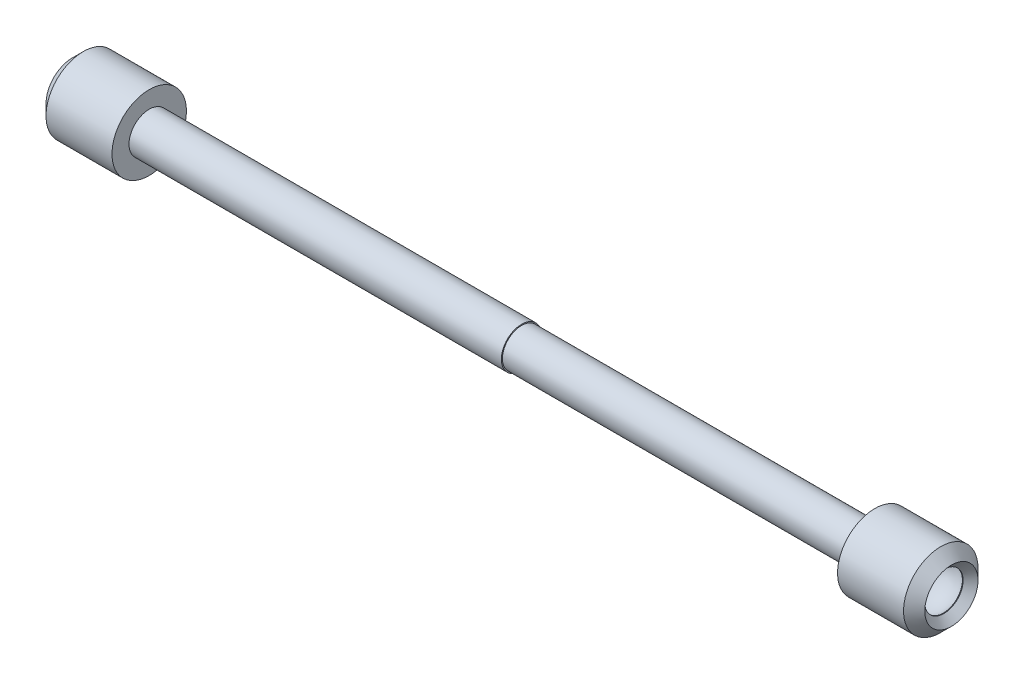
from build123d import *

# Parameters (mm, degrees)
SZKIC1_R                    = 9
DODANIE_WYCI_GNI_CIE1_DEPTH = 166
SZKIC2_R                    = 9.5
DODANIE_WYCI_GNI_CIE2_DEPTH = 175
SZKIC3_R                    = 17.5
DODANIE_WYCI_GNI_CIE3_DEPTH = 36
SFAZOWANIE1_SIZE            = 5
WYTNIJ_WYCI_GNI_CIE1_START  = -10
SZKIC8_R                    = 9
WYTNIJ_WYCI_GNI_CIE1_DEPTH  = 10
SFAZOWANIE3_SIZE            = 3.5
SFAZOWANIE1_OF_LUSTRO7_SIZE = 5
SFAZOWANIE3_OF_LUSTRO7_SIZE = 3.5


with BuildPart() as part:
    # Szkic1 → Dodanie-wyciągnięcie1 (new body)
    with BuildSketch(Plane(origin=(0, 0, 0), x_dir=(0, 0, -1), z_dir=(1, 0, 0))):
        Circle(SZKIC1_R)
    extrude(amount=DODANIE_WYCI_GNI_CIE1_DEPTH)

    # Szkic2 → Dodanie-wyciągnięcie2 (add)
    with BuildSketch(Plane.ZY):
        Circle(SZKIC2_R)
    extrude(amount=DODANIE_WYCI_GNI_CIE2_DEPTH)

    # Szkic3 → Dodanie-wyciągnięcie3 (add)
    with BuildSketch(Plane(origin=(166, 0, 0), x_dir=(0, 0, -1), z_dir=(1, 0, 0))):
        Circle(SZKIC3_R)
    dodanie_wyci_gni_cie3 = extrude(amount=DODANIE_WYCI_GNI_CIE3_DEPTH)

    # Sfazowanie1
    sfazowanie1_edges = [part.edges().sort_by_distance(p)[0] for p in [
        (202, 0, 17.5),
    ]]
    chamfer(sfazowanie1_edges, length=SFAZOWANIE1_SIZE)

    # Szkic8 → Wytnij-wyciągnięcie1 (cut)
    with BuildSketch(Plane(origin=(202, 0, 0), x_dir=(0, 0, -1), z_dir=(1, 0, 0)).offset(WYTNIJ_WYCI_GNI_CIE1_START)):
        Circle(SZKIC8_R)
    wytnij_wyci_gni_cie1 = extrude(amount=WYTNIJ_WYCI_GNI_CIE1_DEPTH, mode=Mode.SUBTRACT)

    # Szkic4 → Wycięcie-obrót9 (revolve, cut)
    with BuildSketch(Plane.XY):
        with BuildLine():
            Line((189.5, 12.5), (189.5, -12.5))
            ThreePointArc((189.5, -12.5), (202, 0), (189.5, 12.5))
        make_face()
    wyci_cie_obr_t9 = revolve(axis=Axis((189.5, 12.5, 0), (0, -1, 0)), mode=Mode.SUBTRACT)

    # Sfazowanie3
    sfazowanie3_edges = [part.edges().sort_by_distance(p)[0] for p in [
        (202, 0, 9),
    ]]
    chamfer(sfazowanie3_edges, length=SFAZOWANIE3_SIZE - 0.0001)  # a hair under: the kernel refuses the full size

    # Lustro7: Dodanie-wyciągnięcie3, Wytnij-wyciągnięcie1, Wycięcie-obrót9 across plane
    add(dodanie_wyci_gni_cie3.mirror(Plane.ZY.offset(4.5)))
    add(wytnij_wyci_gni_cie1.mirror(Plane.ZY.offset(4.5)), mode=Mode.SUBTRACT)
    add(wyci_cie_obr_t9.mirror(Plane.ZY.offset(4.5)), mode=Mode.SUBTRACT)

    # Sfazowanie1 of Lustro7
    sfazowanie1_of_lustro7_edges = [part.edges().sort_by_distance(p)[0] for p in [
        (-211, 0, 17.5),
    ]]
    chamfer(sfazowanie1_of_lustro7_edges, length=SFAZOWANIE1_OF_LUSTRO7_SIZE)

    # Sfazowanie3 of Lustro7
    sfazowanie3_of_lustro7_edges = [part.edges().sort_by_distance(p)[0] for p in [
        (-211, 0, 9),
    ]]
    chamfer(sfazowanie3_of_lustro7_edges, length=SFAZOWANIE3_OF_LUSTRO7_SIZE - 0.0001)  # a hair under: the kernel refuses the full size


solid = part.part
